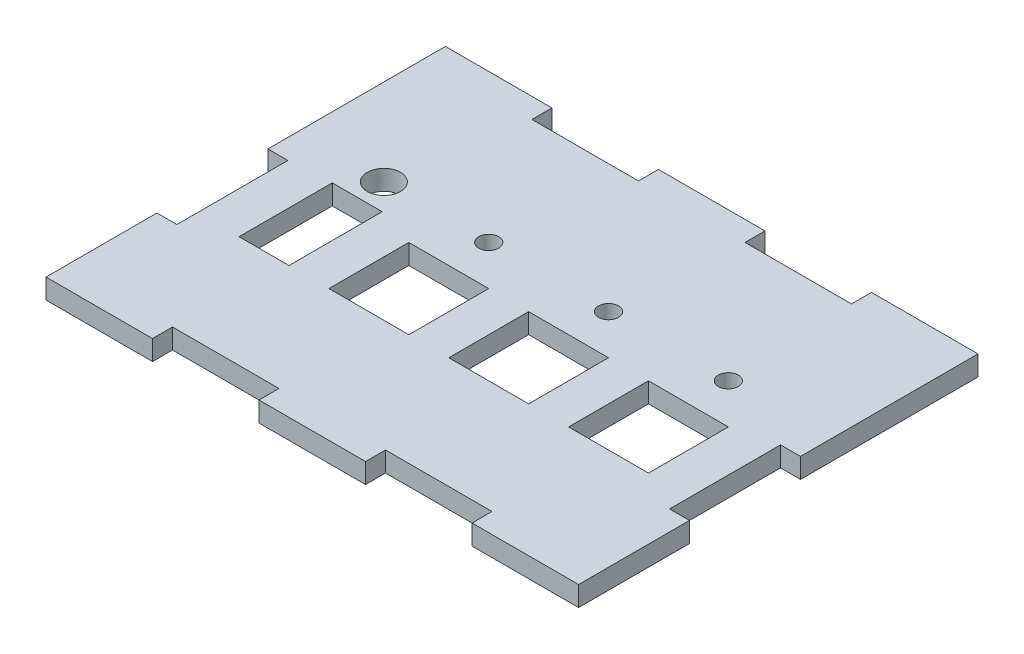
from build123d import *

# Parameters (mm, degrees)
TOP_AND_BOTTOM_R              = 1.5
TOP_AND_BOTTOM_R_2            = 2.5
TOP_AND_BOTTOM_W              = 12
TOP_AND_BOTTOM_H              = 12
TOP_AND_BOTTOM_W_2            = 7.5
TOP_AND_BOTTOM_H_2            = 14
TOP_AND_BOTTOM_EXTRUDED_DEPTH = 3


with BuildPart() as part:
    # Top and Bottom → Top and Bottom Extruded (new body)
    with BuildSketch(Plane(origin=(0, 0, 0), x_dir=(1, 0, 0), z_dir=(0, 1, 0))):
        Polygon((32, 60), (48, 60), (48, 57), (64, 57), (64, 60), (80, 60), (80, 33.333333333), (77, 33.333333333), (77, 16.666666667), (80, 16.666666667), (80, 0), (64, 0), (64, 3), (48, 3), (48, 0), (32, 0), (32, 3), (16, 3), (16, 0), (0, 0), (0, 16.666666667), (3, 16.666666667), (3, 33.333333333), (0, 33.333333333), (0, 60), (16, 60), (16, 57), (32, 57), align=None)
        with Locations((28.75, 37.75)):
            Circle(TOP_AND_BOTTOM_R, mode=Mode.SUBTRACT)
        with Locations((46.75, 37.75)):
            Circle(TOP_AND_BOTTOM_R, mode=Mode.SUBTRACT)
        with Locations((64.75, 37.75)):
            Circle(TOP_AND_BOTTOM_R, mode=Mode.SUBTRACT)
        with Locations((13, 37.75)):
            Circle(TOP_AND_BOTTOM_R_2, mode=Mode.SUBTRACT)
        with Locations((46.75, 25.75)):
            Rectangle(TOP_AND_BOTTOM_W, TOP_AND_BOTTOM_H, mode=Mode.SUBTRACT)
        with Locations((28.75, 25.75)):
            Rectangle(TOP_AND_BOTTOM_W, TOP_AND_BOTTOM_H, mode=Mode.SUBTRACT)
        with Locations((64.75, 25.75)):
            Rectangle(TOP_AND_BOTTOM_W, TOP_AND_BOTTOM_H, mode=Mode.SUBTRACT)
        with Locations((13, 26.75)):
            Rectangle(TOP_AND_BOTTOM_W_2, TOP_AND_BOTTOM_H_2, mode=Mode.SUBTRACT)
    extrude(amount=TOP_AND_BOTTOM_EXTRUDED_DEPTH)


solid = part.part
